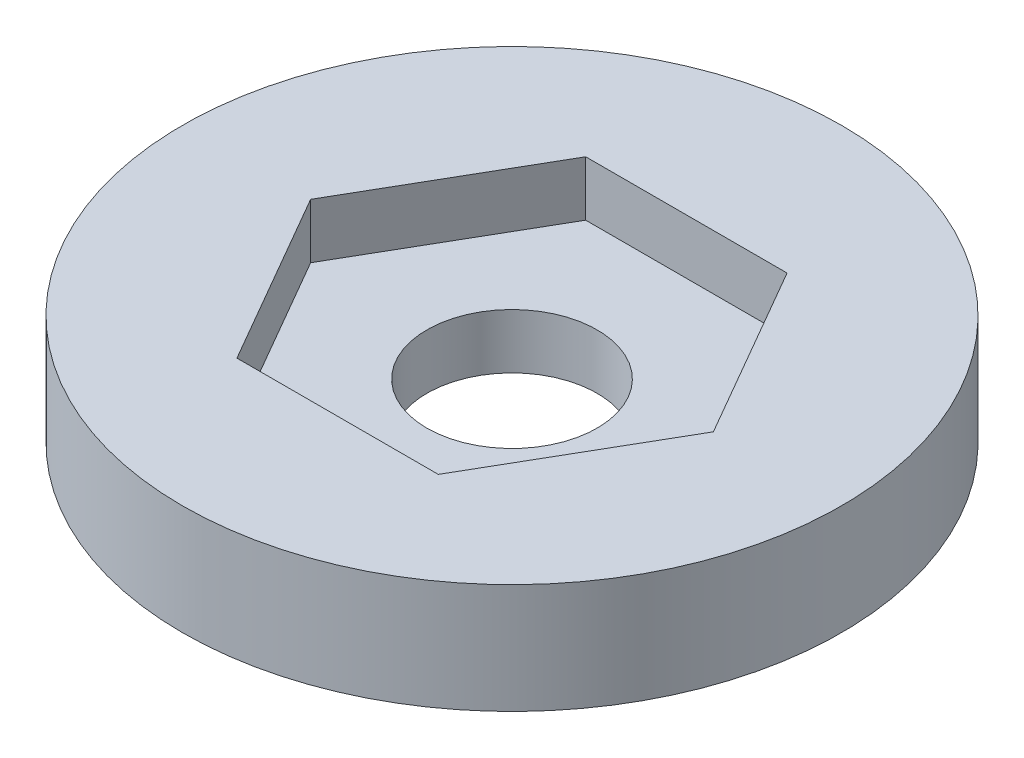
from build123d import *

# Parameters (mm, degrees)
SKETCH1_R           = 12
SKETCH1_R_2         = 3.1
BOSS_EXTRUDE1_DEPTH = 4
CUT_EXTRUDE1_DEPTH  = 2


with BuildPart() as part:
    # Sketch1 → Boss-Extrude1 (new body)
    with BuildSketch(Plane(origin=(0, 0, 0), x_dir=(1, 0, 0), z_dir=(0, 1, 0))):
        Circle(SKETCH1_R)
        Circle(SKETCH1_R_2, mode=Mode.SUBTRACT)
    extrude(amount=BOSS_EXTRUDE1_DEPTH)

    # Sketch2 → Cut-Extrude1 (cut)
    with BuildSketch(Plane(origin=(0, 4, 0), x_dir=(1, 0, 0), z_dir=(0, 1, 0))):
        Polygon((7.332348419, 0), (3.666174209, 6.35), (-3.666174209, 6.35), (-7.332348419, 0), (-3.666174209, -6.35), (3.666174209, -6.35), align=None)
    extrude(amount=-CUT_EXTRUDE1_DEPTH, mode=Mode.SUBTRACT)


solid = part.part
